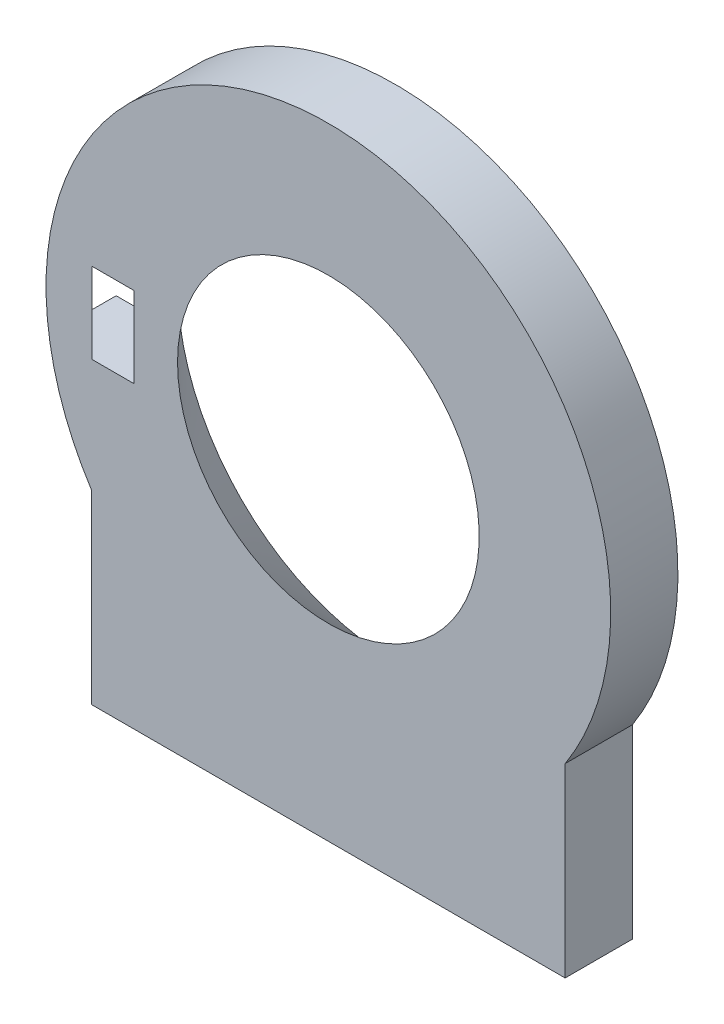
from build123d import *

# Parameters (mm, degrees)
BOSS_EXTRUDE1_DEPTH = 10
SKETCH4_R           = 22.437608593
CUT_EXTRUDE1_DEPTH  = 30
CHAMFER1_SIZE       = 10


with BuildPart() as part:
    # Sketch1 → Boss-Extrude1 (new body)
    with BuildSketch(Plane.XY):
        with BuildLine():
            Line((-35.220966732, -22.879761853), (-35.220966732, -50.5))
            Line((-35.220966732, -50.5), (35.220966732, -50.5))
            Line((35.220966732, -50.5), (35.220966732, -22.879761853))
            ThreePointArc((35.220966732, -22.879761853), (0, 42), (-35.220966732, -22.879761853))
        make_face()
    extrude(amount=BOSS_EXTRUDE1_DEPTH)

    # Sketch3 → Cut-Loft1 section 0
    with BuildSketch(Plane.XY.offset(10)):
        with BuildLine():
            Line((-35.164273033, 6), (-28.90529198, 6))
            Line((-28.90529198, 6), (-28.90529198, -6))
            Line((-28.90529198, -6), (-35.164273033, -6))
            Line((-35.164273033, -6), (-35.164273033, 6))
        make_face()
    # Sketch2 → Cut-Loft1 section 1
    with BuildSketch(Plane(origin=(0, 0, 0), x_dir=(-1, 0, 0), z_dir=(0, 0, -1))):
        with BuildLine():
            Line((32.638910343, 6), (49.791813943, 6))
            Line((49.791813943, 6), (49.791813943, -6))
            Line((49.791813943, -6), (32.638910343, -6))
            Line((32.638910343, -6), (32.638910343, 6))
        make_face()
    loft(mode=Mode.SUBTRACT)

    # Sketch4 → Cut-Extrude1 (cut)
    with BuildSketch(Plane(origin=(0, 0, 0), x_dir=(-1, 0, 0), z_dir=(0, 0, -1))):
        Circle(SKETCH4_R)
    extrude(amount=-CUT_EXTRUDE1_DEPTH, mode=Mode.SUBTRACT)

    # Chamfer1
    chamfer1_edges = [part.edges().sort_by_distance(p)[0] for p in [
        (22.437608593, 0, 0),
    ]]
    chamfer(chamfer1_edges, length=CHAMFER1_SIZE - 0.0001)  # a hair under: the kernel refuses the full size


solid = part.part
